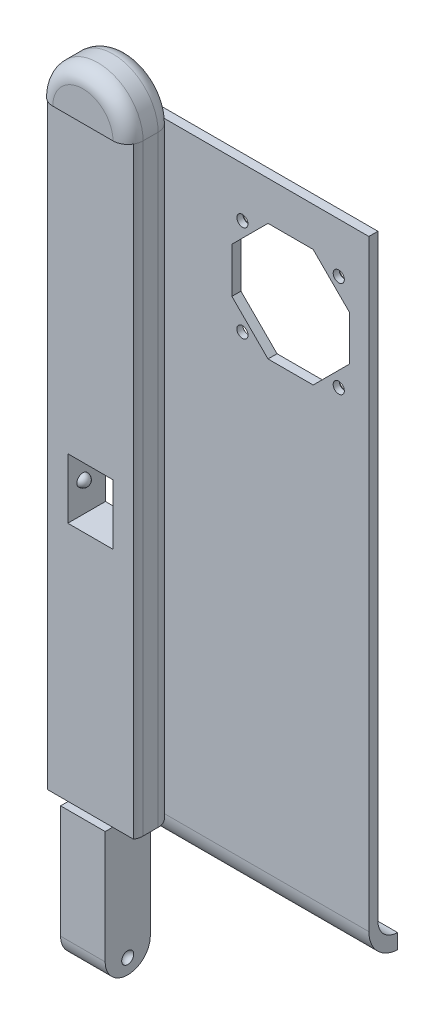
from build123d import *

# Parameters (mm, degrees)
BOSS_EXTRUDE1_DEPTH = 7.5
FILLET1_R           = 5
SKETCH4_W           = 15
SKETCH4_H           = 20
CUT_EXTRUDE1_DEPTH  = 152.492574085
CUT_EXTRUDE2_DEPTH  = 152.848641751
BOSS_EXTRUDE2_DEPTH = 80
BOSS_EXTRUDE3_START = 5
BOSS_EXTRUDE3_DEPTH = 5
SKETCH9_W           = 12.5
SKETCH9_H           = 20
CUT_EXTRUDE3_DEPTH  = 3
SKETCH10_W          = 2.5
SKETCH10_H          = 200
CUT_EXTRUDE4_DEPTH  = 175.180940404
SKETCH11_R          = 1.85
CUT_EXTRUDE5_DEPTH  = 167.580310961
SKETCH12_R          = 3
SKETCH12_R_2        = 3.25
CUT_EXTRUDE6_DEPTH  = 1


with BuildPart() as part:
    # Sketch1 → Boss-Extrude1 (new, symmetric)
    with BuildSketch(Plane.XY):
        with BuildLine():
            Line((-7.4, -150), (7.4, -150))
            Line((7.4, -150), (7.4, -100))
            Line((7.4, -100), (15, -100))
            Line((15, -100), (15, 100))
            ThreePointArc((15, 100), (0, 115), (-15, 100))
            Line((-15, 100), (-15, -100))
            Line((-15, -100), (-7.4, -100))
            Line((-7.4, -100), (-7.4, -150))
        make_face()
    extrude(amount=BOSS_EXTRUDE1_DEPTH, both=True)

    # Fillet1
    fillet1_edges = [part.edges().sort_by_distance(p)[0] for p in [
        (15, 0, -7.5),
        (0, 115, -7.5),
        (15, 0, 7.5),
        (0, 115, 7.5),
        (-7.4, -150, 0),
        (7.4, -150, 0),
        (-15, 0, -7.5),
        (-15, 0, 7.5),
    ]]
    fillet(fillet1_edges, radius=FILLET1_R)

    # Sketch4 → Cut-Extrude1 (cut, through all)
    with BuildSketch(Plane.XY.offset(7.5)):
        with Locations((0, -10)):
            Rectangle(SKETCH4_W, SKETCH4_H)
    extrude(amount=-CUT_EXTRUDE1_DEPTH, mode=Mode.SUBTRACT)

    # Sketch5 → Revolve2 (revolve)
    with BuildSketch(Plane.XY):
        with BuildLine():
            Line((-7.5, -10), (-5.5, -10))
            ThreePointArc((-5.5, -10), (-6.085786438, -8.585786438), (-7.5, -8))
            Line((-7.5, -8), (-7.5, -10))
        make_face()
        with BuildLine():
            Line((7.5, -10), (5.5, -10))
            ThreePointArc((5.5, -10), (6.085786438, -8.585786438), (7.5, -8))
            Line((7.5, -8), (7.5, -10))
        make_face()
    revolve(axis=Axis((-21.965922243, -10, 0), (1, 0, 0)))

    # Sketch2 → Cut-Revolve1 (revolve, cut)
    with BuildSketch(Plane.XY):
        with BuildLine():
            Line((-7.4, -138), (-7.4, -140))
            Line((-7.4, -140), (-5.4, -140))
            ThreePointArc((-5.4, -140), (-5.985786438, -138.585786438), (-7.4, -138))
        make_face()
        with BuildLine():
            Line((7.4, -138), (7.4, -140))
            Line((7.4, -140), (5.4, -140))
            ThreePointArc((5.4, -140), (5.985786438, -138.585786438), (7.4, -138))
        make_face()
    revolve(axis=Axis((-23.291382295, -140, 0), (1, 0, 0)), mode=Mode.SUBTRACT)

    # Sketch6 → Cut-Extrude2 (cut, through all)
    with BuildSketch(Plane.ZY.offset(7.4)):
        with BuildLine():
            Line((-7.5, -137.5), (-7.5, -150))
            Line((-7.5, -150), (7.5, -150))
            Line((7.5, -150), (7.5, -137.5))
            ThreePointArc((7.5, -137.5), (0, -145), (-7.5, -137.5))
        make_face()
    extrude(amount=-CUT_EXTRUDE2_DEPTH, mode=Mode.SUBTRACT)

    # Sketch3 → Boss-Extrude2 (add)
    with BuildSketch(Plane(origin=(0, 0, 0), x_dir=(0, 0, -1), z_dir=(1, 0, 0))):
        with BuildLine():
            Line((17, -109.987492178), (17, -104.987492178))
            ThreePointArc((17, -104.987492178), (12.403805922, -103.083686255), (10.5, -98.487492178))
            Line((10.5, -98.487492178), (10.5, 100))
            Line((10.5, 100), (7.5, 100))
            Line((7.5, 100), (7.5, -100))
            ThreePointArc((7.5, -100), (10.254311627, -106.892024376), (17, -109.987492178))
        make_face()
    extrude(amount=BOSS_EXTRUDE2_DEPTH)

    # Sketch7 → Boss-Extrude3 (add)
    with BuildSketch(Plane.ZY.offset(BOSS_EXTRUDE3_START)):
        with BuildLine():
            Line((-10.5, 100), (-7.5, 100))
            Line((-7.5, 100), (-7.5, 0))
            Line((-7.5, 0), (-7.5, -20))
            Line((-7.5, -20), (-7.5, -100))
            ThreePointArc((-7.5, -100), (-10.254311627, -106.892024376), (-17, -109.987492178))
            Line((-17, -109.987492178), (-17, -104.987492178))
            ThreePointArc((-17, -104.987492178), (-12.403805922, -103.083686255), (-10.5, -98.487492178))
            Line((-10.5, -98.487492178), (-10.5, 100))
        make_face()
    extrude(amount=-BOSS_EXTRUDE3_DEPTH)

    # Sketch9 → Cut-Extrude3 (cut)
    with BuildSketch(Plane(origin=(0, 0, -10.5), x_dir=(-1, 0, 0), z_dir=(0, 0, -1))):
        with Locations((-1.25, -10)):
            Rectangle(SKETCH9_W, SKETCH9_H)
    extrude(amount=-CUT_EXTRUDE3_DEPTH, mode=Mode.SUBTRACT)

    # Sketch10 → Cut-Extrude4 (cut, through all)
    with BuildSketch(Plane.ZY.offset(15)):
        with Locations((6.25, 0)):
            Rectangle(SKETCH10_W, SKETCH10_H)
    extrude(amount=-CUT_EXTRUDE4_DEPTH, mode=Mode.SUBTRACT)

    # Sketch11 → Cut-Extrude5 (cut, through all)
    with BuildSketch(Plane(origin=(0, 0, -10.5), x_dir=(-1, 0, 0), z_dir=(0, 0, -1))):
        with Locations((-38, 83.512507822)):
            Circle(SKETCH11_R)
        with Locations((-38, 51.512507822)):
            Circle(SKETCH11_R)
        with Locations((-70, 83.512507822)):
            Circle(SKETCH11_R)
        with Locations((-70, 51.512507822)):
            Circle(SKETCH11_R)
        Polygon((-46.5, 87.012507822), (-61.5, 87.012507822), (-73.5, 75.012507822), (-73.5, 60.012507822), (-61.5, 48.012507822), (-46.5, 48.012507822), (-34.5, 60.012507822), (-34.5, 75.012507822), align=None)
    extrude(amount=-CUT_EXTRUDE5_DEPTH, mode=Mode.SUBTRACT)

    # Sketch12 → Cut-Extrude6 (cut)
    with BuildSketch(Plane(origin=(0, 0, -10.5), x_dir=(-1, 0, 0), z_dir=(0, 0, -1))):
        with Locations((-38, 83.512507822)):
            Circle(SKETCH12_R)
        with Locations((-70, 83.512507822)):
            Circle(SKETCH12_R)
        with Locations((-70, 51.512507822)):
            Circle(SKETCH12_R)
        with Locations((-38, 51.512507822)):
            Circle(SKETCH12_R_2)
    extrude(amount=-CUT_EXTRUDE6_DEPTH, mode=Mode.SUBTRACT)


solid = part.part
